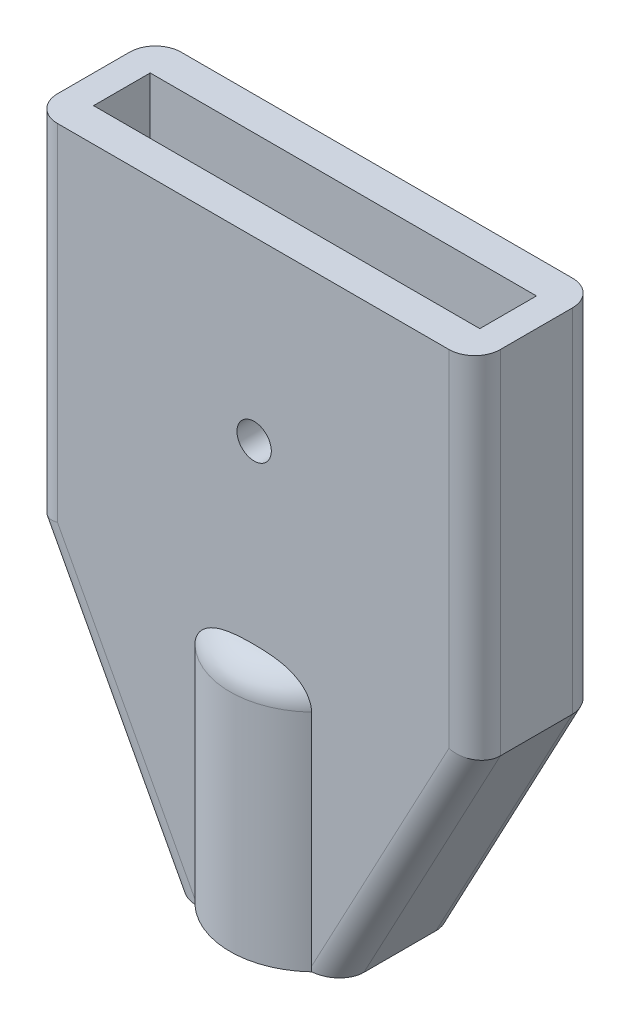
from build123d import *

# Parameters (mm, degrees)
SKETCH2_W               = 25.8
SKETCH2_H               = 7.2
BOSS_EXTRUDE1_DEPTH     = 20.5
SKETCH3_W               = 22.5
SKETCH3_H               = 3.3
CUT_EXTRUDE1_DEPTH      = 18
CUT_EXTRUDE2_DEPTH      = 34.730253483
CUT_EXTRUDE2_DEPTH_BACK = 34.730253483
SKETCH4_R               = 1
SKETCH9_R               = 4.95
BOSS_EXTRUDE6_DEPTH     = 14.9
BOSS_EXTRUDE7_DEPTH     = 7.2
SKETCH12_R              = 2.95
CUT_EXTRUDE5_DEPTH      = 13.5
FILLET2_R               = 1.5
FILLET3_R               = 1.8


with BuildPart() as part:
    # Sketch2 → Boss-Extrude1 (new body)
    with BuildSketch(Plane(origin=(0, 0, 0), x_dir=(1, 0, 0), z_dir=(0, 1, 0))):
        with Locations((12.9, 3.6)):
            Rectangle(SKETCH2_W, SKETCH2_H)
    extrude(amount=BOSS_EXTRUDE1_DEPTH)

    # Sketch3 → Cut-Extrude1 (cut)
    with BuildSketch(Plane(origin=(0, 20.5, 0), x_dir=(1, 0, 0), z_dir=(0, 1, 0))):
        with Locations((12.9, 3.6)):
            Rectangle(SKETCH3_W, SKETCH3_H)
    extrude(amount=-CUT_EXTRUDE1_DEPTH, mode=Mode.SUBTRACT)

    # Sketch4 → Cut-Extrude2 (cut, two sides: drawn at the far end of the back side and taken through both)
    with BuildSketch(Plane(origin=(0, 0, -7.2), x_dir=(-1, 0, 0), z_dir=(0, 0, -1)).offset(-CUT_EXTRUDE2_DEPTH_BACK)):
        with Locations((-12.953971153, 10.2)):
            Circle(SKETCH4_R)
    extrude(amount=CUT_EXTRUDE2_DEPTH + CUT_EXTRUDE2_DEPTH_BACK, mode=Mode.SUBTRACT)

    # Sketch9 → Boss-Extrude6 (add)
    with BuildSketch(Plane(origin=(0, 0, 0), x_dir=(-1, 0, 0), z_dir=(0, -1, 0))):
        with Locations(Location((-12.9, 3.6, 0), (0, 0, 226.658241773))):
            Circle(SKETCH9_R)
    extrude(amount=BOSS_EXTRUDE6_DEPTH)

    # Sketch11 → Boss-Extrude7 (add)
    with BuildSketch(Plane(origin=(0, 0, -7.2), x_dir=(-1, 0, 0), z_dir=(0, 0, -1))):
        Polygon((-9.502574504, 0), (-12.9, 0), (-12.9, -14.9), (-7.95, -14.9), (0, 0), align=None)
        Polygon((-12.9, -14.9), (-12.9, 0), (-16.297425496, 0), (-25.8, 0), (-17.85, -14.9), align=None)
    extrude(amount=-BOSS_EXTRUDE7_DEPTH)

    # Sketch12 → Cut-Extrude5 (cut)
    with BuildSketch(Plane(origin=(0, -14.9, 0), x_dir=(-1, 0, 0), z_dir=(0, -1, 0))):
        with Locations(Location((-12.9, 3.6, 0), (0, 0, 90))):
            Circle(SKETCH12_R)
    extrude(amount=-CUT_EXTRUDE5_DEPTH, mode=Mode.SUBTRACT)

    # Fillet2
    # the kernel refuses this fillet: 1.5 mm, written as the material it takes off along each edge
    with BuildSketch(Plane(origin=(0, -3.75, -7.2), x_dir=(0, 0, 1), z_dir=(0, 1, 0)), Plane(origin=(0, -3.75, 0), x_dir=(1, 0, 0), z_dir=(0, 1, 0))) as fillet2_piece_1:
        with BuildLine():
            CenterArc((FILLET2_R, FILLET2_R), FILLET2_R, 180, 90)
            Line((0, FILLET2_R), (0, 0))
            Line((0, 0), (FILLET2_R, 0))
        make_face()
    extrude(amount=28, mode=Mode.SUBTRACT)
    with BuildSketch(Plane(origin=(9.715282105, -18.208516146, -7.2), x_dir=(0, 0, 1), z_dir=(-0.47074189463756383, 0.8822709723395851, 0))) as fillet2_piece_2_section:
        with BuildLine():
            CenterArc((FILLET2_R, FILLET2_R), FILLET2_R, 180, 90)
            Line((0, FILLET2_R), (0, 0))
            Line((0, 0), (FILLET2_R, 0))
        make_face()
    fillet2_piece_2 = extrude(amount=24.38823555, mode=Mode.PRIVATE)
    fillet2_piece_2 = fillet2_piece_2 - Plane(origin=(12.9, -7.082671963, -3.6), x_dir=(0.686348585021791, 0, 0.727272727275391), z_dir=(0, 1, 0)) * Cylinder(4.95, 55, mode=Mode.PRIVATE)
    add(fillet2_piece_2, mode=Mode.SUBTRACT)
    with BuildSketch(Plane(origin=(9.715282105, -18.208516146, 0), x_dir=(0.8822709723395851, 0.4707418946375639, 0), z_dir=(-0.47074189463756383, 0.8822709723395851, 0))) as fillet2_piece_3_section:
        with BuildLine():
            CenterArc((FILLET2_R, FILLET2_R), FILLET2_R, 180, 90)
            Line((0, FILLET2_R), (0, 0))
            Line((0, 0), (FILLET2_R, 0))
        make_face()
    fillet2_piece_3 = extrude(amount=24.38823555, mode=Mode.PRIVATE)
    fillet2_piece_3 = fillet2_piece_3 - Plane(origin=(12.9, -7.08267196, -3.6), x_dir=(0.686348585021791, 0, 0.727272727275391), z_dir=(0, 1, 0)) * Cylinder(4.95, 55, mode=Mode.PRIVATE)
    add(fillet2_piece_3, mode=Mode.SUBTRACT)
    with BuildSketch(Plane(origin=(27.565282105, 3.308516146, -7.2), x_dir=(0, 0, 1), z_dir=(-0.4707418946375641, -0.882270972339585, 0))) as fillet2_piece_4_section:
        with BuildLine():
            CenterArc((FILLET2_R, FILLET2_R), FILLET2_R, 180, 90)
            Line((0, FILLET2_R), (0, 0))
            Line((0, 0), (FILLET2_R, 0))
        make_face()
    fillet2_piece_4 = extrude(amount=24.38823555, mode=Mode.PRIVATE)
    fillet2_piece_4 = fillet2_piece_4 - Plane(origin=(12.9, -7.082671987, -3.6), x_dir=(0.686348585021791, 0, 0.727272727275391), z_dir=(0, 1, 0)) * Cylinder(4.95, 55, mode=Mode.PRIVATE)
    add(fillet2_piece_4, mode=Mode.SUBTRACT)
    with BuildSketch(Plane(origin=(27.565282105, 3.308516146, 0), x_dir=(-0.8822709723395848, 0.47074189463756405, 0), z_dir=(-0.4707418946375641, -0.882270972339585, 0))) as fillet2_piece_5_section:
        with BuildLine():
            CenterArc((FILLET2_R, FILLET2_R), FILLET2_R, 180, 90)
            Line((0, FILLET2_R), (0, 0))
            Line((0, 0), (FILLET2_R, 0))
        make_face()
    fillet2_piece_5 = extrude(amount=24.38823555, mode=Mode.PRIVATE)
    fillet2_piece_5 = fillet2_piece_5 - Plane(origin=(12.9, -7.082671971, -3.6), x_dir=(0.686348585021791, 0, 0.727272727275391), z_dir=(0, 1, 0)) * Cylinder(4.95, 55, mode=Mode.PRIVATE)
    add(fillet2_piece_5, mode=Mode.SUBTRACT)
    with BuildSketch(Plane(origin=(25.8, -3.75, 0), x_dir=(-1, 0, 0), z_dir=(0, 1, 0)), Plane(origin=(25.8, -3.75, -7.2), x_dir=(0, 0, 1), z_dir=(0, 1, 0))) as fillet2_piece_6:
        with BuildLine():
            CenterArc((FILLET2_R, -FILLET2_R), FILLET2_R, 90, 90)
            Line((0, -FILLET2_R), (0, 0))
            Line((0, 0), (FILLET2_R, 0))
        make_face()
    extrude(amount=28, mode=Mode.SUBTRACT)

    # Fillet3
    # the kernel refuses this fillet: 1.8 mm, written as the material it takes off along each edge
    with BuildSketch(Plane(origin=(12.9, 0, -3.6), x_dir=(0.9954823771301547, 0, -0.09494649452874186), z_dir=(-0.09494649452874186, 0, -0.9954823771301547))) as fillet3_piece_1_section:
        with BuildLine():
            CenterArc((4.95 - FILLET3_R, FILLET3_R), FILLET3_R, 270, 90)
            Line((4.95 - FILLET3_R, 0), (4.95, 0))
            Line((4.95, 0), (4.95, FILLET3_R))
        make_face()
    fillet3_piece_1 = revolve(axis=Axis((12.9, 0, -3.6), (0, -1, 0)), revolution_arc=190.896480509, mode=Mode.PRIVATE)
    fillet3_piece_1 = split(fillet3_piece_1, bisect_by=Plane(origin=(12.9, -0.687334204, 0), z_dir=(0, 0, 1)), keep=Keep.TOP, mode=Mode.PRIVATE)
    add(fillet3_piece_1, mode=Mode.SUBTRACT)
    with BuildSketch(Plane(origin=(12.9, 0, -3.6), x_dir=(-0.9954823771297855, 0, 0.09494649453261288), z_dir=(0.09494649453261288, 0, 0.9954823771297855))) as fillet3_piece_2_section:
        with BuildLine():
            CenterArc((4.95 - FILLET3_R, FILLET3_R), FILLET3_R, 270, 90)
            Line((4.95 - FILLET3_R, 0), (4.95, 0))
            Line((4.95, 0), (4.95, FILLET3_R))
        make_face()
    fillet3_piece_2 = revolve(axis=Axis((12.9, 0, -3.6), (0, -1, 0)), revolution_arc=190.89648051, mode=Mode.PRIVATE)
    fillet3_piece_2 = split(fillet3_piece_2, bisect_by=Plane(origin=(12.9, -0.687334204, -7.2), z_dir=(0, 0, -1)), keep=Keep.TOP, mode=Mode.PRIVATE)
    add(fillet3_piece_2, mode=Mode.SUBTRACT)


solid = part.part
